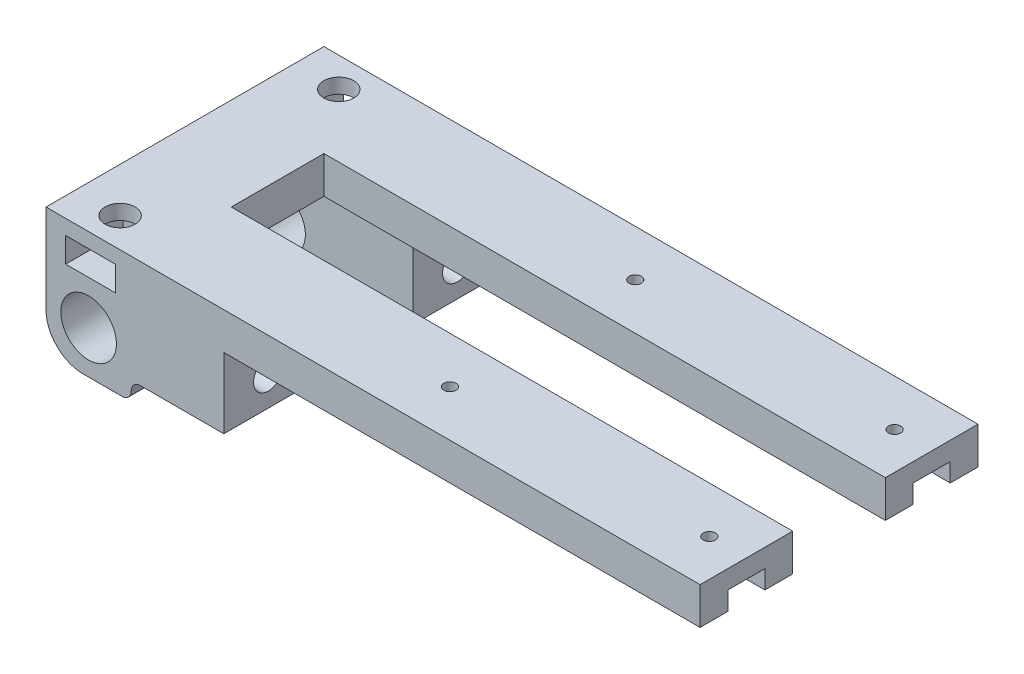
from build123d import *

# Parameters (mm, degrees)
BOSS_EXTRUDE1_DEPTH = 10
SKETCH2_W           = 90
SKETCH2_H           = 10
CUT_EXTRUDE1_DEPTH  = 5
SKETCH3_R           = 1.65
CUT_EXTRUDE2_DEPTH  = 129.723786073
SKETCH5_W           = 23
SKETCH5_H           = 24
BOSS_EXTRUDE2_DEPTH = 24
SKETCH6_R           = 7.5
CUT_EXTRUDE3_DEPTH  = 144.649772109
SKETCH7_W           = 25
SKETCH7_H           = 24
BOSS_EXTRUDE3_DEPTH = 19
SKETCH8_R           = 4
CUT_EXTRUDE4_DEPTH  = 25
FILLET2_R           = 10
SKETCH12_W          = 13.4
SKETCH12_H          = 6.7
CUT_EXTRUDE5_DEPTH  = 15.5
CUT_EXTRUDE6_START  = -75
SKETCH12_2_W        = 13.4
SKETCH12_2_H        = 6.7
CUT_EXTRUDE6_DEPTH  = 15.5
CUT_EXTRUDE7_REACH  = 135.044
SKETCH13_R          = 4.05
FILLET3_R           = 2.5


with BuildPart() as part:
    # Sketch1 → Boss-Extrude1 (new body)
    with BuildSketch(Plane(origin=(0, 0, 0), x_dir=(1, 0, 0), z_dir=(0, 1, 0))):
        Polygon((-120.142652821, 45.940788785), (56.357347179, 45.940788785), (56.357347179, 20.940788785), (-95.142652821, 20.940788785), (-95.142652821, -4.059211215), (56.357347179, -4.059211215), (56.357347179, -29.059211215), (-120.142652821, -29.059211215), align=None)
    extrude(amount=BOSS_EXTRUDE1_DEPTH)

    # Sketch2 → Cut-Extrude1 (cut)
    with BuildSketch(Plane(origin=(0, 0, 0), x_dir=(1, 0, 0), z_dir=(0, 1, 0))):
        with Locations((11.357347179, 33.440788785)):
            Rectangle(SKETCH2_W, SKETCH2_H)
        with Locations((11.357347179, -16.559211215)):
            Rectangle(SKETCH2_W, SKETCH2_H)
    extrude(amount=CUT_EXTRUDE1_DEPTH, mode=Mode.SUBTRACT)

    # Sketch3 → Cut-Extrude2 (cut, through all)
    with BuildSketch(Plane(origin=(0, 5, 0), x_dir=(-1, 0, 0), z_dir=(0, -1, 0))):
        with Locations(Location((23.642652821, 33.440788785, 0), (0, 0, 90))):
            Circle(SKETCH3_R)
        with Locations(Location((-46.357347179, 33.440788785, 0), (0, 0, 90))):
            Circle(SKETCH3_R)
        with Locations(Location((23.642652821, -16.559211215, 0), (0, 0, 90))):
            Circle(SKETCH3_R)
        with Locations(Location((-46.357347179, -16.559211215, 0), (0, 0, 90))):
            Circle(SKETCH3_R)
    extrude(amount=-CUT_EXTRUDE2_DEPTH, mode=Mode.SUBTRACT)

    # Sketch5 → Boss-Extrude2 (add)
    with BuildSketch(Plane.XZ):
        with Locations((-108.642652821, 17.059211215)):
            Rectangle(SKETCH5_W, SKETCH5_H)
        with Locations((-108.642652821, -33.940788785)):
            Rectangle(SKETCH5_W, SKETCH5_H)
    extrude(amount=BOSS_EXTRUDE2_DEPTH)

    # Sketch6 → Cut-Extrude3 (cut, through all)
    with BuildSketch(Plane.XY.offset(29.059211215)):
        with Locations((-108.642652821, -12.5)):
            Circle(SKETCH6_R)
    extrude(amount=-CUT_EXTRUDE3_DEPTH, mode=Mode.SUBTRACT)

    # Sketch7 → Boss-Extrude3 (add)
    with BuildSketch(Plane.XZ):
        with Locations((-84.642652821, -33.940788785)):
            Rectangle(SKETCH7_W, SKETCH7_H)
        with Locations((-84.642652821, 17.059211215)):
            Rectangle(SKETCH7_W, SKETCH7_H)
    extrude(amount=BOSS_EXTRUDE3_DEPTH)

    # Sketch8 → Cut-Extrude4 (cut)
    with BuildSketch(Plane.ZY.offset(72.142652821)):
        with Locations(Location((-33.940788785, -11, 0), (0, 0, 180))):
            Circle(SKETCH8_R)
        with Locations(Location((17.059211215, -11, 0), (0, 0, 180))):
            Circle(SKETCH8_R)
    extrude(amount=CUT_EXTRUDE4_DEPTH, mode=Mode.SUBTRACT)

    # Fillet2
    fillet2_edges = [part.edges().sort_by_distance(p)[0] for p in [
        (-120.142652821, -24, 17.059211215),
        (-120.142652821, -24, -33.940788785),
    ]]
    fillet(fillet2_edges, radius=FILLET2_R)

    # Sketch12 → Cut-Extrude5 (cut)
    with BuildSketch(Plane(origin=(0, 0, -45.940788785), x_dir=(-1, 0, 0), z_dir=(0, 0, -1))):
        with Locations((108.142652821, 2.65)):
            Rectangle(SKETCH12_W, SKETCH12_H)
    extrude(amount=-CUT_EXTRUDE5_DEPTH, mode=Mode.SUBTRACT)

    # Sketch12<2> → Cut-Extrude6 (cut)
    with BuildSketch(Plane(origin=(0, 0, -45.940788785), x_dir=(-1, 0, 0), z_dir=(0, 0, -1)).offset(CUT_EXTRUDE6_START)):
        with Locations((108.142652821, 2.65)):
            Rectangle(SKETCH12_2_W, SKETCH12_2_H)
    extrude(amount=CUT_EXTRUDE6_DEPTH, mode=Mode.SUBTRACT)

    # Sketch13 → Cut-Extrude7 (cut, up to next)
    with BuildSketch(Plane(origin=(0, 10, 0), x_dir=(1, 0, 0), z_dir=(0, 1, 0)), mode=Mode.PRIVATE) as cut_extrude7_sk1:
        with Locations(Location((-108.142652821, 37.940788785, 0), (0, 0, 270))):
            Circle(SKETCH13_R)
    cut_extrude7_tool1 = extrude(cut_extrude7_sk1.sketch, amount=-CUT_EXTRUDE7_REACH, mode=Mode.PRIVATE) & part.part
    # Sketch13 → Cut-Extrude7 (cut, up to next)
    with BuildSketch(Plane(origin=(0, 10, 0), x_dir=(1, 0, 0), z_dir=(0, 1, 0)), mode=Mode.PRIVATE) as cut_extrude7_sk2:
        with Locations(Location((-108.142652821, -21.059211215, 0), (0, 0, 270))):
            Circle(SKETCH13_R)
    cut_extrude7_tool2 = extrude(cut_extrude7_sk2.sketch, amount=-CUT_EXTRUDE7_REACH, mode=Mode.PRIVATE) & part.part
    add(cut_extrude7_tool1.solids().sort_by_distance((-108.142653, 10, -37.940789))[0], mode=Mode.SUBTRACT)
    add(cut_extrude7_tool2.solids().sort_by_distance((-108.142653, 10, 21.059211))[0], mode=Mode.SUBTRACT)

    # Fillet3
    fillet3_edges = [part.edges().sort_by_distance(p)[0] for p in [
        (-97.142652821, -19, -33.940788785),
        (-97.142652821, -19, 17.059211215),
    ]]
    fillet(fillet3_edges, radius=FILLET3_R)
    fillet3_2_edges = [part.edges().sort_by_distance(p)[0] for p in [
        (-97.142652821, -24, -33.940788785),
        (-97.142652821, -24, 17.059211215),
    ]]
    fillet(fillet3_2_edges, radius=FILLET3_R - 0.0001)  # a hair under: the kernel refuses the full size


solid = part.part
